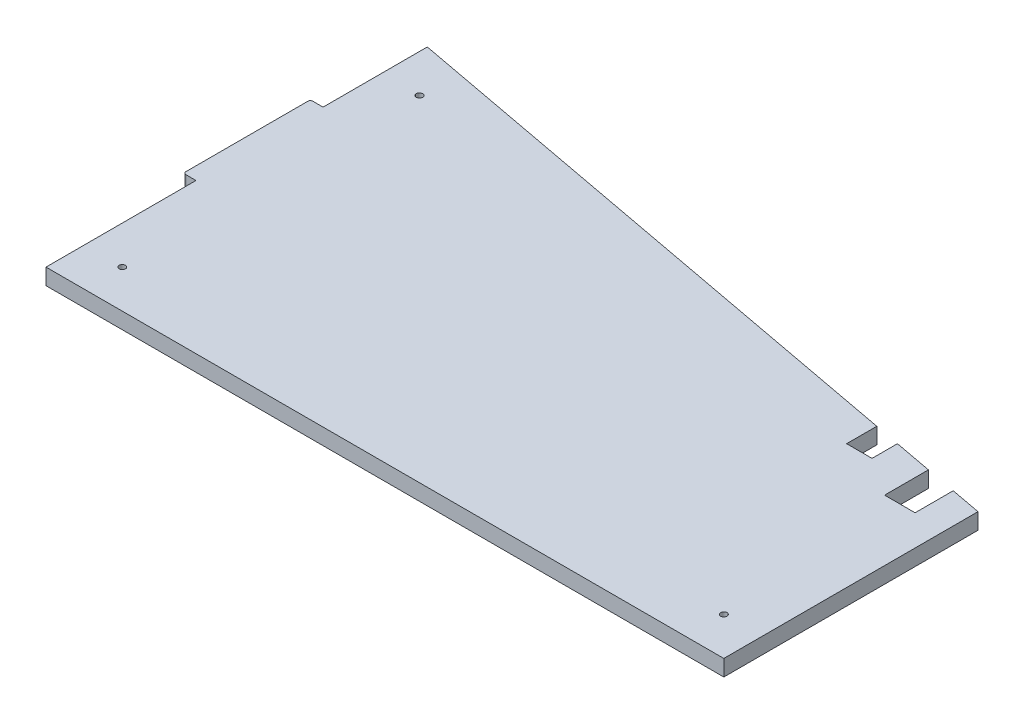
from build123d import *

# Parameters (mm, degrees)
SKETCH2_R           = 1.25
BOSS_EXTRUDE1_DEPTH = 6.35


with BuildPart() as part:
    # Sketch2 → Boss-Extrude1 (new body)
    with BuildSketch(Plane(origin=(0, 0, 0), x_dir=(1, 0, 0), z_dir=(0, 1, 0))):
        with BuildLine():
            Line((0, 0), (266.65, 0))
            Line((266.65, 0), (266.65, 100))
            Line((266.65, 100), (254.65, 102.250140634))
            Line((254.65, 102.250140634), (254.65, 87.250140634))
            Line((254.65, 87.250140634), (242.65, 87.250140634))
            Line((242.65, 87.250140634), (242.65, 104.500281268))
            Line((242.65, 104.500281268), (227.65, 107.31295706))
            Line((227.65, 107.31295706), (227.65, 97.31295706))
            Line((227.65, 97.31295706), (217.65, 97.31295706))
            Line((217.65, 97.31295706), (217.65, 109.188074255))
            Line((217.65, 109.188074255), (0, 150))
            Line((0, 150), (0, 109))
            Line((0, 109), (-4, 109))
            ThreePointArc((-4, 109), (-4.707106781, 108.707106781), (-5, 108))
            Line((-5, 108), (-5, 60))
            ThreePointArc((-5, 60), (-4.707106781, 59.292893219), (-4, 59))
            Line((-4, 59), (0, 59))
            Line((0, 59), (0, 0))
        make_face()
        with Locations((15, 15)):
            Circle(SKETCH2_R, mode=Mode.SUBTRACT)
        with Locations((251.65, 15)):
            Circle(SKETCH2_R, mode=Mode.SUBTRACT)
        with Locations((15, 131.925897501)):
            Circle(SKETCH2_R, mode=Mode.SUBTRACT)
    extrude(amount=BOSS_EXTRUDE1_DEPTH)


solid = part.part
